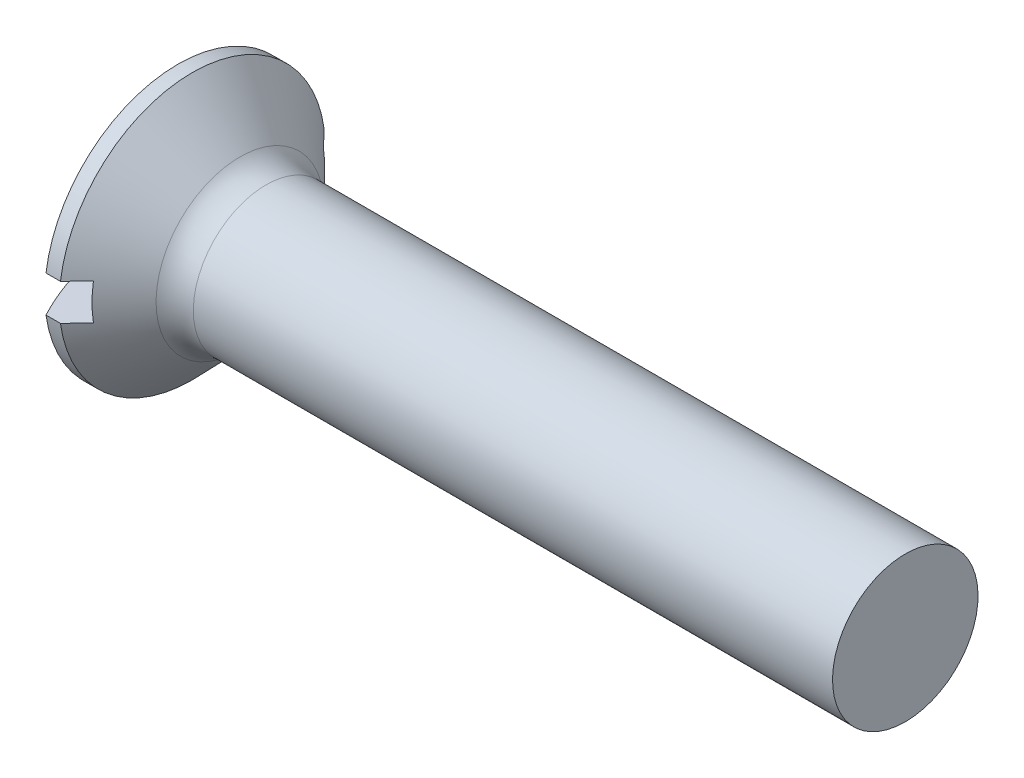
from build123d import *

# Parameters (mm, degrees)
FILLET1_R  = 2.5
SLOTSKE_W  = 18.3
SLOTSKE_H  = 2.5
SLOT_DEPTH = 4.4


with BuildPart() as part:
    # BodySke → BaseBody (revolve)
    with BuildSketch(Plane.XY):
        with BuildLine():
            Line((2.3, 9.15), (3.292391585, 9.15))
            Line((3.292391585, 9.15), (7.3, 5))
            Line((7.3, 5), (52.3, 5))
            Line((52.3, 5), (52.3, 0))
            Line((52.3, 0), (2.3, 0))
            Line((2.3, 0), (0, 0))
            ThreePointArc((0, 0), (0.583806737, 4.717321804), (2.3, 9.15))
        make_face()
    revolve(axis=Axis((2.3, 0, 0), (1, 0, 0)))

    # Fillet1
    fillet1_edges = [part.edges().sort_by_distance(p)[0] for p in [
        (7.3, -5, 0),
    ]]
    fillet(fillet1_edges, radius=FILLET1_R)

    # SlotSke → Slot (cut)
    with BuildSketch(Plane(origin=(0, 0, 0), x_dir=(0, 0, -1), z_dir=(1, 0, 0))):
        Rectangle(SLOTSKE_W, SLOTSKE_H)
    extrude(amount=SLOT_DEPTH, mode=Mode.SUBTRACT)


solid = part.part
